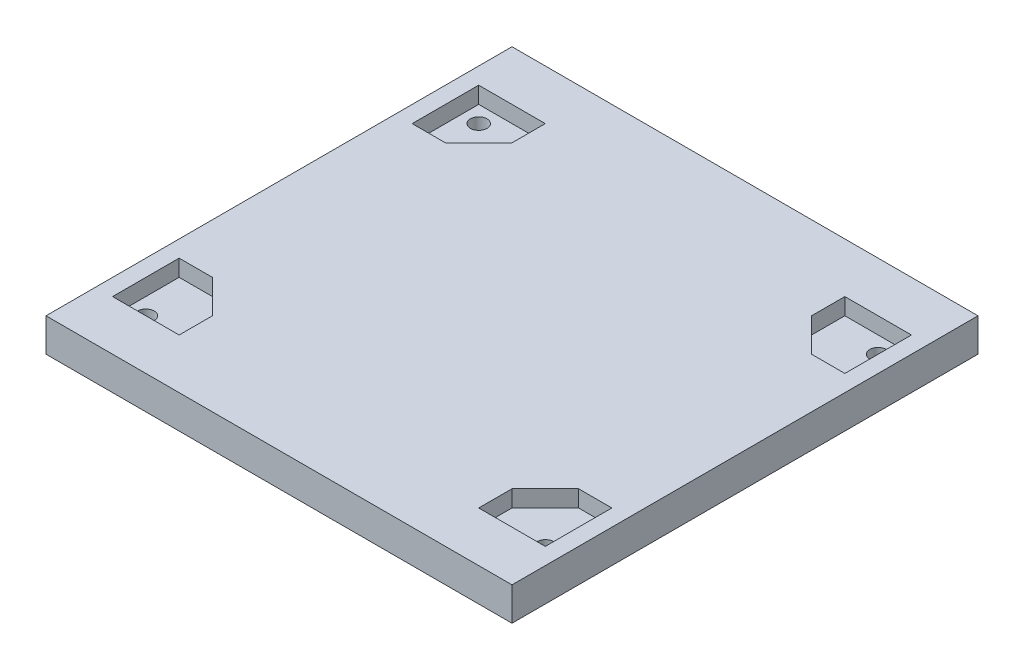
from build123d import *

# Parameters (mm, degrees)
SKETCH1_W               = 84
SKETCH1_H               = 84
BOSS_EXTRUDE1_DEPTH     = 6
SKETCH2_R               = 1.5
CUT_EXTRUDE1_DEPTH      = 119.94536561
SKETCH4_R               = 1.5
CUT_EXTRUDE4_DEPTH      = 3
MIRROR3_COPY_1_SKETCH_R = 1.5
MIRROR3_COPY_1_DEPTH    = 3
MIRROR3_COPY_2_SKETCH_R = 1.5
MIRROR3_COPY_2_DEPTH    = 3


with BuildPart() as part:
    # Sketch1 → Boss-Extrude1 (new body)
    with BuildSketch(Plane(origin=(0, 0, 0), x_dir=(1, 0, 0), z_dir=(0, 1, 0))):
        with Locations((42, 42)):
            Rectangle(SKETCH1_W, SKETCH1_H)
    extrude(amount=BOSS_EXTRUDE1_DEPTH)

    # Sketch2 → Cut-Extrude1 (cut, through all)
    with BuildSketch(Plane(origin=(0, 6, 0), x_dir=(1, 0, 0), z_dir=(0, 1, 0))):
        with Locations((6, 72)):
            Circle(SKETCH2_R)
        with Locations((6, 12)):
            Circle(SKETCH2_R)
        with Locations((78, 12)):
            Circle(SKETCH2_R)
        with Locations((78, 72)):
            Circle(SKETCH2_R)
    extrude(amount=-CUT_EXTRUDE1_DEPTH, mode=Mode.SUBTRACT)

    # Sketch4 → Cut-Extrude4 (cut)
    with BuildSketch(Plane(origin=(0, 6, 0), x_dir=(1, 0, 0), z_dir=(0, 1, 0))):
        Polygon((9, 21), (3, 21), (3, 9), (15, 9), (15, 15), align=None)
        with Locations((6, 12)):
            Circle(SKETCH4_R, mode=Mode.SUBTRACT)
    cut_extrude4 = extrude(amount=-CUT_EXTRUDE4_DEPTH, mode=Mode.SUBTRACT)

    # Mirror2: Cut-Extrude4 across plane
    add(cut_extrude4.mirror(Plane.XY.offset(-42)), mode=Mode.SUBTRACT)

    # Mirror3 copy 1 sketch → Mirror3 copy 1 (cut)
    with BuildSketch(Plane(origin=(84, 6, -84), x_dir=(-1, 0, 0), z_dir=(0, 1, 0))):
        Polygon((9, 21), (3, 21), (3, 9), (15, 9), (15, 15), align=None)
        with Locations((6, 12)):
            Circle(MIRROR3_COPY_1_SKETCH_R, mode=Mode.SUBTRACT)
    extrude(amount=-MIRROR3_COPY_1_DEPTH, mode=Mode.SUBTRACT)

    # Mirror3 copy 2 sketch → Mirror3 copy 2 (cut)
    with BuildSketch(Plane(origin=(84, 6, 0), x_dir=(-1, 0, 0), z_dir=(0, 1, 0))):
        Polygon((9, -21), (3, -21), (3, -9), (15, -9), (15, -15), align=None)
        with Locations((6, -12)):
            Circle(MIRROR3_COPY_2_SKETCH_R, mode=Mode.SUBTRACT)
    extrude(amount=-MIRROR3_COPY_2_DEPTH, mode=Mode.SUBTRACT)


solid = part.part
